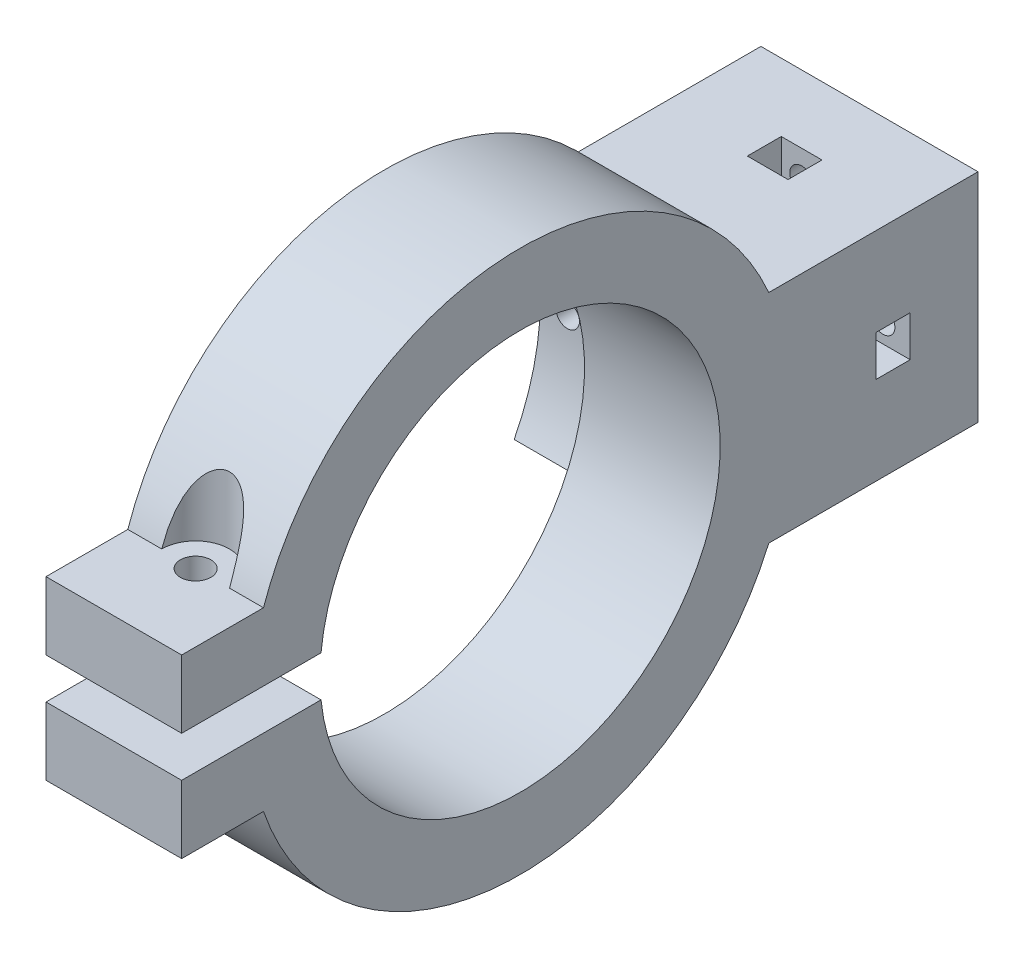
from build123d import *

# Parameters (mm, degrees)
BOSS_EXTRUDE1_DEPTH       = 32
SKETCH4_R                 = 16
CUT_EXTRUDE3_DEPTH        = 15
SKETCH5_R                 = 7
SKETCH5_R_2               = 4
BOSS_EXTRUDE2_DEPTH       = 17
SKETCH15_W                = 16
SKETCH15_H                = 32
CUT_EXTRUDE6_DEPTH        = 15
SKETCH16_W                = 32
SKETCH16_H                = 32
BOSS_EXTRUDE6_DEPTH       = 30
SKETCH17_R                = 1.75
CUT_EXTRUDE8_DEPTH        = 53.92447449
CUT_EXTRUDE10_START       = -10
CUT_EXTRUDE10_DEPTH       = 5
SKETCH20_R                = 4.25
CUT_EXTRUDE11_DEPTH       = 39
CUT_EXTRUDE12_DEPTH       = 10
SKETCH22_R                = 6.5
CUT_EXTRUDE13_DEPTH       = 10
SKETCH23_R                = 1.75
CUT_EXTRUDE14_DEPTH       = 10
CUT_EXTRUDE16_REACH       = 64.498
SKETCH24_R                = 22.5
BOSS_EXTRUDE7_START       = 11.749999897
BOSS_EXTRUDE7_DEPTH       = 8.500000103
SKETCH26_R                = 8.5
CUT_EXTRUDE17_DEPTH       = 10
SKETCH27_R                = 16
BOSS_EXTRUDE8_DEPTH       = 7
SKETCH28_R                = 35
CUT_EXTRUDE18_DEPTH       = 63.498000008
BOSS_EXTRUDE9_START       = -7
SKETCH29_R                = 35
BOSS_EXTRUDE9_DEPTH       = 7
BOSS_EXTRUDE10_DEPTH      = 3
SKETCH31_R                = 15
CUT_EXTRUDE19_DEPTH       = 69.804069679
SKETCH32_R                = 2.2
CUT_EXTRUDE20_DEPTH       = 69.804069679
BOSS_EXTRUDE11_DEPTH      = 10
BOSS_EXTRUDE11_DEPTH_BACK = 10
SKETCH33_R                = 40
SKETCH33_R_2              = 29.5
CUT_EXTRUDE21_START       = -10
SKETCH34_R                = 29.5
CUT_EXTRUDE21_DEPTH       = 10
SKETCH35_W                = 26.144944591
SKETCH35_H                = 6
CUT_EXTRUDE22_DEPTH       = 71.887234394
SKETCH36_W                = 13.986084995
SKETCH36_H                = 10
BOSS_EXTRUDE12_DEPTH      = 20
CUT_EXTRUDE23_DEPTH       = 88.893005187
CUT_EXTRUDE23_DEPTH_BACK  = 88.893005187
SKETCH37_R                = 2.25
SKETCH38_R                = 5
CUT_EXTRUDE24_DEPTH       = 88.893005284
CUT_EXTRUDE25_DEPTH       = 88.893005284


# Read off the part's stored shape, not the designer's step: Boss-Extrude7
with BuildPart() as part:
    # Sketch1 → Boss-Extrude1 (new body)
    with BuildSketch(Plane(origin=(0, 0, 0), x_dir=(0, -1, 0), z_dir=(1, 0, 0))):
        with BuildLine():
            ThreePointArc((-16, 0), (0, 16), (16, 0))
            Line((16, 0), (16, 25))
            Line((16, 25), (-16, 25))
            Line((-16, 25), (-16, 0))
        make_face()
        with BuildLine():
            ThreePointArc((-4.5, 0), (0, 4.5), (4.5, 0))
            Line((4.5, 0), (16, 0))
            ThreePointArc((16, 0), (0, 16), (-16, 0))
            Line((-16, 0), (-4.5, 0))
        make_face()
        with BuildLine():
            Line((16, 0), (4.5, 0))
            ThreePointArc((4.5, 0), (0, -4.5), (-4.5, 0))
            Line((-4.5, 0), (-16, 0))
            ThreePointArc((-16, 0), (0, -16), (16, 0))
        make_face()
        with BuildLine():
            ThreePointArc((-4.5, 0), (0, 4.5), (4.5, 0))
            Line((4.5, 0), (16, 0))
            ThreePointArc((16, 0), (0, 16), (-16, 0))
            Line((-16, 0), (-4.5, 0))
        make_face()
        with BuildLine():
            Line((16, 0), (4.5, 0))
            ThreePointArc((4.5, 0), (0, -4.5), (-4.5, 0))
            Line((-4.5, 0), (-16, 0))
            ThreePointArc((-16, 0), (0, -16), (16, 0))
        make_face()
    extrude(amount=BOSS_EXTRUDE1_DEPTH)

    # Sketch4 → Cut-Extrude3 (cut)
    with BuildSketch(Plane.ZY):
        Circle(SKETCH4_R)
    extrude(amount=-CUT_EXTRUDE3_DEPTH, mode=Mode.SUBTRACT)

    # Sketch5 → Boss-Extrude2 (add)
    with BuildSketch(Plane.ZY.offset(-15)):
        Circle(SKETCH5_R)
        Circle(SKETCH5_R_2, mode=Mode.SUBTRACT)
    extrude(amount=-BOSS_EXTRUDE2_DEPTH)

    # Sketch15 → Cut-Extrude6 (cut)
    with BuildSketch(Plane.ZY):
        with Locations((-8, 0)):
            Rectangle(SKETCH15_W, SKETCH15_H)
    extrude(amount=-CUT_EXTRUDE6_DEPTH, mode=Mode.SUBTRACT)

    # Sketch16 → Boss-Extrude6 (add)
    with BuildSketch(Plane(origin=(0, 0, -25), x_dir=(-1, 0, 0), z_dir=(0, 0, -1))):
        with Locations((-16, 0)):
            Rectangle(SKETCH16_W, SKETCH16_H)
    extrude(amount=BOSS_EXTRUDE6_DEPTH)

    # Sketch17 → Cut-Extrude8 (cut, through all)
    with BuildSketch(Plane.XY.offset(-16)):
        with Locations((4, 0)):
            Circle(SKETCH17_R)
        with Locations((16, 12)):
            Circle(SKETCH17_R)
        with Locations((28, 0)):
            Circle(SKETCH17_R)
        with Locations((16, -12)):
            Circle(SKETCH17_R)
    extrude(amount=-CUT_EXTRUDE8_DEPTH, mode=Mode.SUBTRACT)

    # Sketch19 → Cut-Extrude10 (cut)
    with BuildSketch(Plane(origin=(0, 0, -55), x_dir=(-1, 0, 0), z_dir=(0, 0, -1)).offset(CUT_EXTRUDE10_START)):
        Polygon((0, 3), (-5.732050808, 3), (-7.464101615, 0), (-5.732050808, -3), (0, -3), align=None)
        Polygon((-16, -8.535898385), (-19, -10.267949192), (-19, -16), (-13, -16), (-13, -10.267949192), align=None)
        Polygon((-24.535898385, 0), (-26.267949192, 3), (-32, 3), (-32, -3), (-26.267949192, -3), align=None)
        Polygon((-16, 8.535898385), (-13, 10.267949192), (-13, 16), (-19, 16), (-19, 10.267949192), align=None)
    extrude(amount=-CUT_EXTRUDE10_DEPTH, mode=Mode.SUBTRACT)

    # Sketch20 → Cut-Extrude11 (cut)
    with BuildSketch(Plane(origin=(0, 0, -55), x_dir=(-1, 0, 0), z_dir=(0, 0, -1))):
        with Locations((-16, 0)):
            Circle(SKETCH20_R)
    extrude(amount=-CUT_EXTRUDE11_DEPTH, mode=Mode.SUBTRACT)

    # Sketch21 → Cut-Extrude12 (cut)
    with BuildSketch(Plane.ZY.offset(-15)):
        with BuildLine():
            Line((0, 16), (-16, 16))
            Line((-16, 16), (-16, 13.436140662))
            Line((-16, 13.436140662), (-16, 10.563859338))
            Line((-16, 10.563859338), (-16, 4.13067791))
            Line((-16, 4.13067791), (-16, -4.13067791))
            Line((-16, -4.13067791), (-16, -10.563859338))
            Line((-16, -10.563859338), (-16, -13.436140662))
            Line((-16, -13.436140662), (-16, -16))
            Line((-16, -16), (0, -16))
            ThreePointArc((0, -16), (16, 0), (0, 16))
        make_face()
    extrude(amount=-CUT_EXTRUDE12_DEPTH, mode=Mode.SUBTRACT)

    # Sketch22 → Cut-Extrude13 (cut)
    with BuildSketch(Plane.ZY.offset(-25)):
        Circle(SKETCH22_R)
    extrude(amount=-CUT_EXTRUDE13_DEPTH, mode=Mode.SUBTRACT)

    # Sketch23 → Cut-Extrude14 (cut)
    with BuildSketch(Plane.ZY.offset(-25)):
        with Locations((0, 12.5)):
            Circle(SKETCH23_R)
        with Locations((0, -12.5)):
            Circle(SKETCH23_R)
    extrude(amount=-CUT_EXTRUDE14_DEPTH, mode=Mode.SUBTRACT)

    # Cut-Extrude16: up to this face of the body (flat: up to its plane)
    cut_extrude16_end = Plane(part.part.faces().sort_by_distance((0, 0, -35.327586207))[0])
    # Sketch24 → Cut-Extrude16 (cut, up to the picked face)
    with BuildSketch(Plane.ZY.offset(-25), mode=Mode.PRIVATE) as cut_extrude16_sk1:
        Circle(SKETCH24_R)
    cut_extrude16_tool1 = split(extrude(cut_extrude16_sk1.sketch, amount=CUT_EXTRUDE16_REACH, mode=Mode.PRIVATE), bisect_by=cut_extrude16_end, keep=Keep.BOTH, mode=Mode.PRIVATE)
    add(cut_extrude16_tool1.solids().sort_by(Axis((25, 0, 0), (-1, 0, 0)))[0], mode=Mode.SUBTRACT)

    # Boss-Extrude7 outline → Boss-Extrude7 (add)
    with BuildSketch(Plane.YZ.offset(BOSS_EXTRUDE7_START)):
        with BuildLine():
            ThreePointArc((6, -21.685248442), (0, -22.5), (-6, -21.685248442))
            Line((-6, -21.685248442), (-6, -30))
            Line((-6, -30), (6, -30))
            Line((6, -30), (6, -21.685248442))
        make_face()
    extrude(amount=BOSS_EXTRUDE7_DEPTH)

    # Sketch26 → Cut-Extrude17 (cut)
    with BuildSketch(Plane.ZY.offset(-25)):
        Circle(SKETCH26_R)
    extrude(amount=-CUT_EXTRUDE17_DEPTH, mode=Mode.SUBTRACT)

    # Sketch27 → Boss-Extrude8 (add)
    with BuildSketch(Plane.ZY.offset(-25)):
        Circle(SKETCH27_R)
    extrude(amount=-BOSS_EXTRUDE8_DEPTH)

    # Sketch28 → Cut-Extrude18 (cut, through all)
    with BuildSketch(Plane.ZY.offset(-25)):
        with Locations((12.5, 0)):
            Circle(SKETCH28_R)
    extrude(amount=CUT_EXTRUDE18_DEPTH, mode=Mode.SUBTRACT)

    # Sketch29 → Boss-Extrude9 (add)
    with BuildSketch(Plane.ZY.offset(-25).offset(BOSS_EXTRUDE9_START)):
        with Locations((12.5, 0)):
            Circle(SKETCH29_R)
    extrude(amount=BOSS_EXTRUDE9_DEPTH)

    # Sketch30 → Boss-Extrude10 (add)
    with BuildSketch(Plane.ZY.offset(-25)):
        with BuildLine():
            ThreePointArc((-18.628764833, -16), (47.5, 0), (-18.628764833, 16))
            ThreePointArc((-18.628764833, 16), (-22.5, 0), (-18.628764833, -16))
        make_face()
    extrude(amount=BOSS_EXTRUDE10_DEPTH)

    # Sketch31 → Cut-Extrude19 (cut, through all)
    with BuildSketch(Plane.ZY.offset(-22)):
        with Locations((12.5, 0)):
            Circle(SKETCH31_R)
    extrude(amount=-CUT_EXTRUDE19_DEPTH, mode=Mode.SUBTRACT)

    # Sketch32 → Cut-Extrude20 (cut, through all)
    with BuildSketch(Plane.ZY.offset(-22)):
        with Locations((12.52327174, 25.399989339)):
            Circle(SKETCH32_R)
        with Locations((-5.444049099, 17.976960309)):
            Circle(SKETCH32_R)
        with Locations((-12.899989339, 0.02327174)):
            Circle(SKETCH32_R)
        with Locations((-5.476960309, -17.944049099)):
            Circle(SKETCH32_R)
        with Locations((12.47672826, -25.399989339)):
            Circle(SKETCH32_R)
        with Locations((30.444049099, -17.976960309)):
            Circle(SKETCH32_R)
        with Locations((30.476960309, 17.944049099)):
            Circle(SKETCH32_R)
    extrude(amount=-CUT_EXTRUDE20_DEPTH, mode=Mode.SUBTRACT)

    # Sketch33 → Boss-Extrude11 (add, two sides: drawn at the far end of the back side and taken through both)
    with BuildSketch(Plane.ZY.offset(-22).offset(-BOSS_EXTRUDE11_DEPTH_BACK)):
        with Locations((12.5, 0)):
            Circle(SKETCH33_R)
        with Locations((12.5, 0)):
            Circle(SKETCH33_R_2, mode=Mode.SUBTRACT)
    extrude(amount=BOSS_EXTRUDE11_DEPTH + BOSS_EXTRUDE11_DEPTH_BACK)

    # Sketch34 → Cut-Extrude21 (cut)
    with BuildSketch(Plane.ZY.offset(-22).offset(CUT_EXTRUDE21_START)):
        with Locations((12.5, 0)):
            Circle(SKETCH34_R)
    extrude(amount=CUT_EXTRUDE21_DEPTH, mode=Mode.SUBTRACT)

    # Sketch35 → Cut-Extrude22 (cut, through all)
    with BuildSketch(Plane.ZY.offset(-12)):
        with Locations((47.365138907, 0)):
            Rectangle(SKETCH35_W, SKETCH35_H)
    extrude(amount=-CUT_EXTRUDE22_DEPTH, mode=Mode.SUBTRACT)

    # Sketch36 → Boss-Extrude12 (add)
    with BuildSketch(Plane.ZY.offset(-12)):
        with Locations((55.394298853, 8)):
            Rectangle(SKETCH36_W, SKETCH36_H)
        with Locations((55.394298853, -8)):
            Rectangle(SKETCH36_W, SKETCH36_H)
    extrude(amount=-BOSS_EXTRUDE12_DEPTH)

    # Sketch37 → Cut-Extrude23 (cut, two sides: drawn at the far end of the back side and taken through both)
    with BuildSketch(Plane(origin=(0, 13, 0), x_dir=(1, 0, 0), z_dir=(0, 1, 0)).offset(-CUT_EXTRUDE23_DEPTH_BACK)):
        with Locations((22, -50.328560639)):
            Circle(SKETCH37_R)
    extrude(amount=CUT_EXTRUDE23_DEPTH + CUT_EXTRUDE23_DEPTH_BACK, mode=Mode.SUBTRACT)

    # Sketch38 → Cut-Extrude24 (cut, through all)
    with BuildSketch(Plane(origin=(0, 13, 0), x_dir=(1, 0, 0), z_dir=(0, 1, 0))):
        with Locations((22, -50.328560639)):
            Circle(SKETCH38_R)
    extrude(amount=CUT_EXTRUDE24_DEPTH, mode=Mode.SUBTRACT)

    # Sketch39 → Cut-Extrude25 (cut, through all)
    with BuildSketch(Plane.XZ.offset(13)):
        Polygon((25.75, 52.493624148), (22, 54.658687658), (18.25, 52.493624148), (18.25, 48.163497129), (22, 45.99843362), (25.75, 48.163497129), align=None)
    extrude(amount=CUT_EXTRUDE25_DEPTH, mode=Mode.SUBTRACT)


solid = part.part
